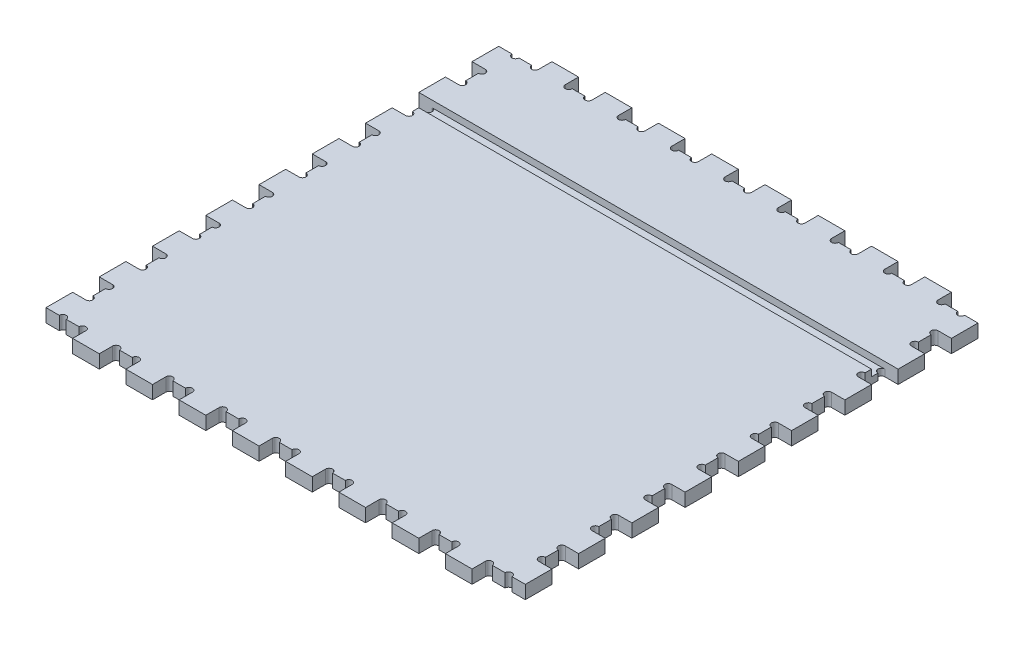
from build123d import *

# Parameters (mm, degrees)
SKETCH1_W               = 457.2
SKETCH1_H               = 457.2
BOSS_EXTRUDE1_DEPTH     = 12.7
CUT_EXTRUDE1_DEPTH      = 12.7
LPATTERN1_COUNT         = 9
LPATTERN1_PITCH         = 50.8
MIRROR1_COPY_1_DEPTH    = 12.7
MIRROR1_COPY_2_DEPTH    = 12.7
MIRROR1_COPY_3_DEPTH    = 12.7
MIRROR1_COPY_4_DEPTH    = 12.7
MIRROR1_COPY_5_DEPTH    = 12.7
MIRROR1_COPY_6_DEPTH    = 12.7
MIRROR1_COPY_7_DEPTH    = 12.7
MIRROR1_COPY_8_DEPTH    = 12.7
MIRROR1_COPY_9_DEPTH    = 12.7
SKETCH3_W               = 12.7
SKETCH3_H               = 12.7
CUT_EXTRUDE2_DEPTH      = 324.538575753
MIRROR3_COPY_1_SKETCH_W = 12.7
MIRROR3_COPY_1_SKETCH_H = 12.7
MIRROR3_COPY_1_DEPTH    = 324.538575753
MIRROR3_COPY_2_SKETCH_W = 12.7
MIRROR3_COPY_2_SKETCH_H = 12.7
MIRROR3_COPY_2_DEPTH    = 324.538575753
CUT_EXTRUDE3_DEPTH      = 324.538575753
LPATTERN2_COUNT         = 9
LPATTERN2_PITCH         = 50.8
MIRROR4_COPY_1_DEPTH    = 324.538575753
MIRROR4_COPY_2_DEPTH    = 324.538575753
MIRROR4_COPY_3_DEPTH    = 324.538575753
MIRROR4_COPY_4_DEPTH    = 324.538575753
MIRROR4_COPY_5_DEPTH    = 324.538575753
MIRROR4_COPY_6_DEPTH    = 324.538575753
MIRROR4_COPY_7_DEPTH    = 324.538575753
MIRROR4_COPY_8_DEPTH    = 324.538575753
MIRROR4_COPY_9_DEPTH    = 324.538575753
SKETCH7_W               = 431.8
SKETCH7_H               = 12.7
CUT_EXTRUDE5_DEPTH      = 6.35


with BuildPart() as part:
    # Sketch1 → Boss-Extrude1 (new body)
    with BuildSketch(Plane(origin=(0, 0, 0), x_dir=(1, 0, 0), z_dir=(0, 1, 0))):
        Rectangle(SKETCH1_W, SKETCH1_H)
    extrude(amount=BOSS_EXTRUDE1_DEPTH)

    # Sketch2 → Cut-Extrude1 (cut)
    with BuildSketch(Plane(origin=(0, 12.7, 0), x_dir=(1, 0, 0), z_dir=(0, 1, 0))):
        with BuildLine():
            Line((-190.5, 228.6), (-215.9, 228.6))
            Line((-215.9, 228.6), (-215.9, 215.9))
            ThreePointArc((-215.9, 215.9), (-212.598, 212.598), (-209.296, 215.9))
            Line((-209.296, 215.9), (-197.104, 215.9))
            ThreePointArc((-197.104, 215.9), (-193.802, 212.598), (-190.5, 215.9))
            Line((-190.5, 215.9), (-190.5, 228.6))
        make_face()
    cut_extrude1 = extrude(amount=-CUT_EXTRUDE1_DEPTH, mode=Mode.SUBTRACT)

    # LPattern1: Cut-Extrude1 ×9
    with Locations(*[(i * LPATTERN1_PITCH, 0, 0) for i in range(1, LPATTERN1_COUNT)]):
        add(cut_extrude1, mode=Mode.SUBTRACT)

    # Mirror1 copy 1 sketch → Mirror1 copy 1 (cut)
    with BuildSketch(Plane(origin=(50.8, 12.7, 0), x_dir=(1, 0, 0), z_dir=(0, 1, 0))):
        with BuildLine():
            Line((-190.5, -228.6), (-215.9, -228.6))
            Line((-215.9, -228.6), (-215.9, -215.9))
            ThreePointArc((-215.9, -215.9), (-212.598, -212.598), (-209.296, -215.9))
            Line((-209.296, -215.9), (-197.104, -215.9))
            ThreePointArc((-197.104, -215.9), (-193.802, -212.598), (-190.5, -215.9))
            Line((-190.5, -215.9), (-190.5, -228.6))
        make_face()
    extrude(amount=-MIRROR1_COPY_1_DEPTH, mode=Mode.SUBTRACT)

    # Mirror1 copy 2 sketch → Mirror1 copy 2 (cut)
    with BuildSketch(Plane(origin=(101.6, 12.7, 0), x_dir=(1, 0, 0), z_dir=(0, 1, 0))):
        with BuildLine():
            Line((-190.5, -228.6), (-215.9, -228.6))
            Line((-215.9, -228.6), (-215.9, -215.9))
            ThreePointArc((-215.9, -215.9), (-212.598, -212.598), (-209.296, -215.9))
            Line((-209.296, -215.9), (-197.104, -215.9))
            ThreePointArc((-197.104, -215.9), (-193.802, -212.598), (-190.5, -215.9))
            Line((-190.5, -215.9), (-190.5, -228.6))
        make_face()
    extrude(amount=-MIRROR1_COPY_2_DEPTH, mode=Mode.SUBTRACT)

    # Mirror1 copy 3 sketch → Mirror1 copy 3 (cut)
    with BuildSketch(Plane(origin=(152.4, 12.7, 0), x_dir=(1, 0, 0), z_dir=(0, 1, 0))):
        with BuildLine():
            Line((-190.5, -228.6), (-215.9, -228.6))
            Line((-215.9, -228.6), (-215.9, -215.9))
            ThreePointArc((-215.9, -215.9), (-212.598, -212.598), (-209.296, -215.9))
            Line((-209.296, -215.9), (-197.104, -215.9))
            ThreePointArc((-197.104, -215.9), (-193.802, -212.598), (-190.5, -215.9))
            Line((-190.5, -215.9), (-190.5, -228.6))
        make_face()
    extrude(amount=-MIRROR1_COPY_3_DEPTH, mode=Mode.SUBTRACT)

    # Mirror1 copy 4 sketch → Mirror1 copy 4 (cut)
    with BuildSketch(Plane(origin=(203.2, 12.7, 0), x_dir=(1, 0, 0), z_dir=(0, 1, 0))):
        with BuildLine():
            Line((-190.5, -228.6), (-215.9, -228.6))
            Line((-215.9, -228.6), (-215.9, -215.9))
            ThreePointArc((-215.9, -215.9), (-212.598, -212.598), (-209.296, -215.9))
            Line((-209.296, -215.9), (-197.104, -215.9))
            ThreePointArc((-197.104, -215.9), (-193.802, -212.598), (-190.5, -215.9))
            Line((-190.5, -215.9), (-190.5, -228.6))
        make_face()
    extrude(amount=-MIRROR1_COPY_4_DEPTH, mode=Mode.SUBTRACT)

    # Mirror1 copy 5 sketch → Mirror1 copy 5 (cut)
    with BuildSketch(Plane(origin=(254, 12.7, 0), x_dir=(1, 0, 0), z_dir=(0, 1, 0))):
        with BuildLine():
            Line((-190.5, -228.6), (-215.9, -228.6))
            Line((-215.9, -228.6), (-215.9, -215.9))
            ThreePointArc((-215.9, -215.9), (-212.598, -212.598), (-209.296, -215.9))
            Line((-209.296, -215.9), (-197.104, -215.9))
            ThreePointArc((-197.104, -215.9), (-193.802, -212.598), (-190.5, -215.9))
            Line((-190.5, -215.9), (-190.5, -228.6))
        make_face()
    extrude(amount=-MIRROR1_COPY_5_DEPTH, mode=Mode.SUBTRACT)

    # Mirror1 copy 6 sketch → Mirror1 copy 6 (cut)
    with BuildSketch(Plane(origin=(304.8, 12.7, 0), x_dir=(1, 0, 0), z_dir=(0, 1, 0))):
        with BuildLine():
            Line((-190.5, -228.6), (-215.9, -228.6))
            Line((-215.9, -228.6), (-215.9, -215.9))
            ThreePointArc((-215.9, -215.9), (-212.598, -212.598), (-209.296, -215.9))
            Line((-209.296, -215.9), (-197.104, -215.9))
            ThreePointArc((-197.104, -215.9), (-193.802, -212.598), (-190.5, -215.9))
            Line((-190.5, -215.9), (-190.5, -228.6))
        make_face()
    extrude(amount=-MIRROR1_COPY_6_DEPTH, mode=Mode.SUBTRACT)

    # Mirror1 copy 7 sketch → Mirror1 copy 7 (cut)
    with BuildSketch(Plane(origin=(355.6, 12.7, 0), x_dir=(1, 0, 0), z_dir=(0, 1, 0))):
        with BuildLine():
            Line((-190.5, -228.6), (-215.9, -228.6))
            Line((-215.9, -228.6), (-215.9, -215.9))
            ThreePointArc((-215.9, -215.9), (-212.598, -212.598), (-209.296, -215.9))
            Line((-209.296, -215.9), (-197.104, -215.9))
            ThreePointArc((-197.104, -215.9), (-193.802, -212.598), (-190.5, -215.9))
            Line((-190.5, -215.9), (-190.5, -228.6))
        make_face()
    extrude(amount=-MIRROR1_COPY_7_DEPTH, mode=Mode.SUBTRACT)

    # Mirror1 copy 8 sketch → Mirror1 copy 8 (cut)
    with BuildSketch(Plane(origin=(406.4, 12.7, 0), x_dir=(1, 0, 0), z_dir=(0, 1, 0))):
        with BuildLine():
            Line((-190.5, -228.6), (-215.9, -228.6))
            Line((-215.9, -228.6), (-215.9, -215.9))
            ThreePointArc((-215.9, -215.9), (-212.598, -212.598), (-209.296, -215.9))
            Line((-209.296, -215.9), (-197.104, -215.9))
            ThreePointArc((-197.104, -215.9), (-193.802, -212.598), (-190.5, -215.9))
            Line((-190.5, -215.9), (-190.5, -228.6))
        make_face()
    extrude(amount=-MIRROR1_COPY_8_DEPTH, mode=Mode.SUBTRACT)

    # Mirror1 copy 9 sketch → Mirror1 copy 9 (cut)
    with BuildSketch(Plane(origin=(0, 12.7, 0), x_dir=(1, 0, 0), z_dir=(0, 1, 0))):
        with BuildLine():
            Line((-190.5, -228.6), (-215.9, -228.6))
            Line((-215.9, -228.6), (-215.9, -215.9))
            ThreePointArc((-215.9, -215.9), (-212.598, -212.598), (-209.296, -215.9))
            Line((-209.296, -215.9), (-197.104, -215.9))
            ThreePointArc((-197.104, -215.9), (-193.802, -212.598), (-190.5, -215.9))
            Line((-190.5, -215.9), (-190.5, -228.6))
        make_face()
    extrude(amount=-MIRROR1_COPY_9_DEPTH, mode=Mode.SUBTRACT)

    # Sketch3 → Cut-Extrude2 (cut, through all)
    with BuildSketch(Plane(origin=(0, 12.7, 0), x_dir=(1, 0, 0), z_dir=(0, 1, 0))):
        with Locations((-222.25, 222.25)):
            Rectangle(SKETCH3_W, SKETCH3_H)
    cut_extrude2 = extrude(amount=-CUT_EXTRUDE2_DEPTH, mode=Mode.SUBTRACT)

    # Mirror2: Cut-Extrude2 across plane
    add(cut_extrude2.mirror(Plane.ZY), mode=Mode.SUBTRACT)

    # Mirror3 copy 1 sketch → Mirror3 copy 1 (cut, through all)
    with BuildSketch(Plane(origin=(0, 12.7, 0), x_dir=(-1, 0, 0), z_dir=(0, 1, 0))):
        with Locations((-222.25, 222.25)):
            Rectangle(MIRROR3_COPY_1_SKETCH_W, MIRROR3_COPY_1_SKETCH_H)
    extrude(amount=-MIRROR3_COPY_1_DEPTH, mode=Mode.SUBTRACT)

    # Mirror3 copy 2 sketch → Mirror3 copy 2 (cut, through all)
    with BuildSketch(Plane(origin=(0, 12.7, 0), x_dir=(1, 0, 0), z_dir=(0, 1, 0))):
        with Locations((-222.25, -222.25)):
            Rectangle(MIRROR3_COPY_2_SKETCH_W, MIRROR3_COPY_2_SKETCH_H)
    extrude(amount=-MIRROR3_COPY_2_DEPTH, mode=Mode.SUBTRACT)

    # Sketch4 → Cut-Extrude3 (cut, through all)
    with BuildSketch(Plane(origin=(0, 12.7, 0), x_dir=(1, 0, 0), z_dir=(0, 1, 0))):
        with BuildLine():
            Line((-215.9, 190.5), (-228.6, 190.5))
            Line((-228.6, 190.5), (-228.6, 165.1))
            Line((-228.6, 165.1), (-215.9, 165.1))
            ThreePointArc((-215.9, 165.1), (-212.598, 168.402), (-215.9, 171.704))
            Line((-215.9, 171.704), (-215.9, 183.896))
            ThreePointArc((-215.9, 183.896), (-212.598, 187.198), (-215.9, 190.5))
        make_face()
    cut_extrude3 = extrude(amount=-CUT_EXTRUDE3_DEPTH, mode=Mode.SUBTRACT)

    # LPattern2: Cut-Extrude3 ×9
    with Locations(*[(0, 0, i * LPATTERN2_PITCH) for i in range(1, LPATTERN2_COUNT)]):
        add(cut_extrude3, mode=Mode.SUBTRACT)

    # Mirror4 copy 1 sketch → Mirror4 copy 1 (cut, through all)
    with BuildSketch(Plane(origin=(0, 12.7, 50.8), x_dir=(-1, 0, 0), z_dir=(0, 1, 0))):
        with BuildLine():
            Line((-215.9, -190.5), (-228.6, -190.5))
            Line((-228.6, -190.5), (-228.6, -165.1))
            Line((-228.6, -165.1), (-215.9, -165.1))
            ThreePointArc((-215.9, -165.1), (-212.598, -168.402), (-215.9, -171.704))
            Line((-215.9, -171.704), (-215.9, -183.896))
            ThreePointArc((-215.9, -183.896), (-212.598, -187.198), (-215.9, -190.5))
        make_face()
    extrude(amount=-MIRROR4_COPY_1_DEPTH, mode=Mode.SUBTRACT)

    # Mirror4 copy 2 sketch → Mirror4 copy 2 (cut, through all)
    with BuildSketch(Plane(origin=(0, 12.7, 101.6), x_dir=(-1, 0, 0), z_dir=(0, 1, 0))):
        with BuildLine():
            Line((-215.9, -190.5), (-228.6, -190.5))
            Line((-228.6, -190.5), (-228.6, -165.1))
            Line((-228.6, -165.1), (-215.9, -165.1))
            ThreePointArc((-215.9, -165.1), (-212.598, -168.402), (-215.9, -171.704))
            Line((-215.9, -171.704), (-215.9, -183.896))
            ThreePointArc((-215.9, -183.896), (-212.598, -187.198), (-215.9, -190.5))
        make_face()
    extrude(amount=-MIRROR4_COPY_2_DEPTH, mode=Mode.SUBTRACT)

    # Mirror4 copy 3 sketch → Mirror4 copy 3 (cut, through all)
    with BuildSketch(Plane(origin=(0, 12.7, 152.4), x_dir=(-1, 0, 0), z_dir=(0, 1, 0))):
        with BuildLine():
            Line((-215.9, -190.5), (-228.6, -190.5))
            Line((-228.6, -190.5), (-228.6, -165.1))
            Line((-228.6, -165.1), (-215.9, -165.1))
            ThreePointArc((-215.9, -165.1), (-212.598, -168.402), (-215.9, -171.704))
            Line((-215.9, -171.704), (-215.9, -183.896))
            ThreePointArc((-215.9, -183.896), (-212.598, -187.198), (-215.9, -190.5))
        make_face()
    extrude(amount=-MIRROR4_COPY_3_DEPTH, mode=Mode.SUBTRACT)

    # Mirror4 copy 4 sketch → Mirror4 copy 4 (cut, through all)
    with BuildSketch(Plane(origin=(0, 12.7, 203.2), x_dir=(-1, 0, 0), z_dir=(0, 1, 0))):
        with BuildLine():
            Line((-215.9, -190.5), (-228.6, -190.5))
            Line((-228.6, -190.5), (-228.6, -165.1))
            Line((-228.6, -165.1), (-215.9, -165.1))
            ThreePointArc((-215.9, -165.1), (-212.598, -168.402), (-215.9, -171.704))
            Line((-215.9, -171.704), (-215.9, -183.896))
            ThreePointArc((-215.9, -183.896), (-212.598, -187.198), (-215.9, -190.5))
        make_face()
    extrude(amount=-MIRROR4_COPY_4_DEPTH, mode=Mode.SUBTRACT)

    # Mirror4 copy 5 sketch → Mirror4 copy 5 (cut, through all)
    with BuildSketch(Plane(origin=(0, 12.7, 254), x_dir=(-1, 0, 0), z_dir=(0, 1, 0))):
        with BuildLine():
            Line((-215.9, -190.5), (-228.6, -190.5))
            Line((-228.6, -190.5), (-228.6, -165.1))
            Line((-228.6, -165.1), (-215.9, -165.1))
            ThreePointArc((-215.9, -165.1), (-212.598, -168.402), (-215.9, -171.704))
            Line((-215.9, -171.704), (-215.9, -183.896))
            ThreePointArc((-215.9, -183.896), (-212.598, -187.198), (-215.9, -190.5))
        make_face()
    extrude(amount=-MIRROR4_COPY_5_DEPTH, mode=Mode.SUBTRACT)

    # Mirror4 copy 6 sketch → Mirror4 copy 6 (cut, through all)
    with BuildSketch(Plane(origin=(0, 12.7, 304.8), x_dir=(-1, 0, 0), z_dir=(0, 1, 0))):
        with BuildLine():
            Line((-215.9, -190.5), (-228.6, -190.5))
            Line((-228.6, -190.5), (-228.6, -165.1))
            Line((-228.6, -165.1), (-215.9, -165.1))
            ThreePointArc((-215.9, -165.1), (-212.598, -168.402), (-215.9, -171.704))
            Line((-215.9, -171.704), (-215.9, -183.896))
            ThreePointArc((-215.9, -183.896), (-212.598, -187.198), (-215.9, -190.5))
        make_face()
    extrude(amount=-MIRROR4_COPY_6_DEPTH, mode=Mode.SUBTRACT)

    # Mirror4 copy 7 sketch → Mirror4 copy 7 (cut, through all)
    with BuildSketch(Plane(origin=(0, 12.7, 355.6), x_dir=(-1, 0, 0), z_dir=(0, 1, 0))):
        with BuildLine():
            Line((-215.9, -190.5), (-228.6, -190.5))
            Line((-228.6, -190.5), (-228.6, -165.1))
            Line((-228.6, -165.1), (-215.9, -165.1))
            ThreePointArc((-215.9, -165.1), (-212.598, -168.402), (-215.9, -171.704))
            Line((-215.9, -171.704), (-215.9, -183.896))
            ThreePointArc((-215.9, -183.896), (-212.598, -187.198), (-215.9, -190.5))
        make_face()
    extrude(amount=-MIRROR4_COPY_7_DEPTH, mode=Mode.SUBTRACT)

    # Mirror4 copy 8 sketch → Mirror4 copy 8 (cut, through all)
    with BuildSketch(Plane(origin=(0, 12.7, 406.4), x_dir=(-1, 0, 0), z_dir=(0, 1, 0))):
        with BuildLine():
            Line((-215.9, -190.5), (-228.6, -190.5))
            Line((-228.6, -190.5), (-228.6, -165.1))
            Line((-228.6, -165.1), (-215.9, -165.1))
            ThreePointArc((-215.9, -165.1), (-212.598, -168.402), (-215.9, -171.704))
            Line((-215.9, -171.704), (-215.9, -183.896))
            ThreePointArc((-215.9, -183.896), (-212.598, -187.198), (-215.9, -190.5))
        make_face()
    extrude(amount=-MIRROR4_COPY_8_DEPTH, mode=Mode.SUBTRACT)

    # Mirror4 copy 9 sketch → Mirror4 copy 9 (cut, through all)
    with BuildSketch(Plane(origin=(0, 12.7, 0), x_dir=(-1, 0, 0), z_dir=(0, 1, 0))):
        with BuildLine():
            Line((-215.9, -190.5), (-228.6, -190.5))
            Line((-228.6, -190.5), (-228.6, -165.1))
            Line((-228.6, -165.1), (-215.9, -165.1))
            ThreePointArc((-215.9, -165.1), (-212.598, -168.402), (-215.9, -171.704))
            Line((-215.9, -171.704), (-215.9, -183.896))
            ThreePointArc((-215.9, -183.896), (-212.598, -187.198), (-215.9, -190.5))
        make_face()
    extrude(amount=-MIRROR4_COPY_9_DEPTH, mode=Mode.SUBTRACT)

    # Sketch7 → Cut-Extrude5 (cut)
    with BuildSketch(Plane(origin=(0, 12.7, 0), x_dir=(1, 0, 0), z_dir=(0, 1, 0))):
        with Locations((0, 133.35)):
            Rectangle(SKETCH7_W, SKETCH7_H)
    extrude(amount=-CUT_EXTRUDE5_DEPTH, mode=Mode.SUBTRACT)


solid = part.part
